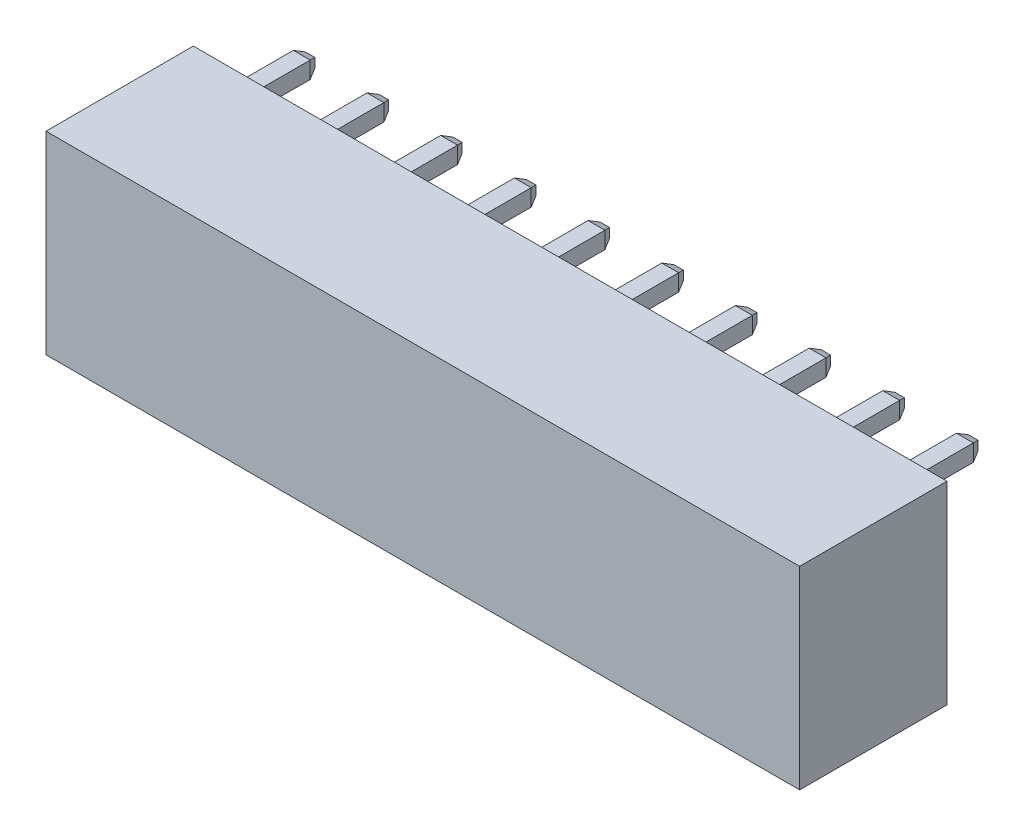
from build123d import *
from OCP.BRepFilletAPI import BRepFilletAPI_MakeChamfer

# Parameters (mm, degrees)
SKETCH_1_W                          = 35.8
SKETCH_1_H                          = 9.2
EXTRUDE_1_DEPTH                     = 7
SKETCH_2_W                          = 0.8
SKETCH_2_H                          = 0.8
EXTRUDE_2_DEPTH                     = 3.4
CHAMFER_1_SIZE                      = 0.4
CHAMFER_1_SIZE2                     = 0.178091474
CUT_EXTRUDE_1_DEPTH                 = 7
PATTERN_LINEAR_1_COUNT              = 10
PATTERN_LINEAR_1_PITCH              = 3.5
CHAMFER_1_OF_PATTERN_LINEAR_1_SIZE  = 0.4
CHAMFER_1_OF_PATTERN_LINEAR_1_SIZE2 = 0.178091474
PATTERN_LINEAR_2_COUNT              = 10
PATTERN_LINEAR_2_PITCH              = 3.5
SKETCH_4_W                          = 0.8
SKETCH_4_H                          = 0.8
EXTRUDE_3_DEPTH                     = 6
CHAMFER_2_SIZE                      = 0.4
CHAMFER_2_SIZE2                     = 0.178091474
PATTERN_LINEAR_3_COUNT              = 10
PATTERN_LINEAR_3_PITCH              = 3.5
CHAMFER_2_OF_PATTERN_LINEAR_3_SIZE  = 0.4
CHAMFER_2_OF_PATTERN_LINEAR_3_SIZE2 = 0.178091474


with BuildPart() as part:
    # Эскиз1 → Бобышка-Вытянуть1 (new body)
    with BuildSketch(Plane.XY):
        with Locations((0, 4.6)):
            Rectangle(SKETCH_1_W, SKETCH_1_H)
    extrude(amount=EXTRUDE_1_DEPTH)

    # Эскиз2 → Бобышка-Вытянуть2 (add)
    with BuildSketch(Plane(origin=(0, 0, 0), x_dir=(-1, 0, 0), z_dir=(0, 0, -1))):
        with Locations((-15.75, 8)):
            Rectangle(SKETCH_2_W, SKETCH_2_H)
    extrude_2 = extrude(amount=EXTRUDE_2_DEPTH)

    # Фаска1: one chamfer whose edges measure the first distance from different faces: ONE call of the kernel's chamfer builder (chamfer() names one face for all edges)
    chamfer_1_edges_1 = [part.edges().sort_by_distance(p)[0] for p in [
        (15.75, 8.4, -3.4),
    ]]
    chamfer_1_side_1 = [part.faces().sort_by_distance(p)[0] for p in [
        (15.75, 8.4, -1.7),
    ]]
    chamfer_1_edges_2 = [part.edges().sort_by_distance(p)[0] for p in [
        (15.35, 8, -3.4),
    ]]
    chamfer_1_side_2 = [part.faces().sort_by_distance(p)[0] for p in [
        (15.35, 8, -1.7),
    ]]
    chamfer_1_edges_3 = [part.edges().sort_by_distance(p)[0] for p in [
        (15.75, 7.6, -3.4),
    ]]
    chamfer_1_side_3 = [part.faces().sort_by_distance(p)[0] for p in [
        (15.75, 7.6, -1.7),
    ]]
    chamfer_1_edges_4 = [part.edges().sort_by_distance(p)[0] for p in [
        (16.15, 8, -3.4),
    ]]
    chamfer_1_side_4 = [part.faces().sort_by_distance(p)[0] for p in [
        (16.15, 8, -1.7),
    ]]
    chamfer_1 = BRepFilletAPI_MakeChamfer(part.part.solid().wrapped)
    for e in chamfer_1_edges_1:
        chamfer_1.Add(CHAMFER_1_SIZE, CHAMFER_1_SIZE2, e.wrapped, chamfer_1_side_1[0].wrapped)  # the first distance lies on this face
    for e in chamfer_1_edges_2:
        chamfer_1.Add(CHAMFER_1_SIZE, CHAMFER_1_SIZE2, e.wrapped, chamfer_1_side_2[0].wrapped)  # the first distance lies on this face
    for e in chamfer_1_edges_3:
        chamfer_1.Add(CHAMFER_1_SIZE, CHAMFER_1_SIZE2, e.wrapped, chamfer_1_side_3[0].wrapped)  # the first distance lies on this face
    for e in chamfer_1_edges_4:
        chamfer_1.Add(CHAMFER_1_SIZE, CHAMFER_1_SIZE2, e.wrapped, chamfer_1_side_4[0].wrapped)  # the first distance lies on this face
    add(Compound.cast(chamfer_1.Shape()), mode=Mode.REPLACE)

    # Эскиз3 → Вырез-Вытянуть1 (cut)
    with BuildSketch(Plane.XZ):
        Polygon((14.15, 0.8), (17.25, 0.8), (17.25, 5), (16.25, 5), (17.25, 6.5), (14.15, 6.5), (15.15, 5), (14.15, 5), align=None)
    cut_extrude_1 = extrude(amount=-CUT_EXTRUDE_1_DEPTH, mode=Mode.SUBTRACT)

    # Линейный массив1: Бобышка-Вытянуть2 ×10
    with Locations(*[(-i * PATTERN_LINEAR_1_PITCH, 0, 0) for i in range(1, PATTERN_LINEAR_1_COUNT)]):
        add(extrude_2)

    # Фаска1 of Линейный массив1: one chamfer whose edges measure the first distance from different faces: ONE call of the kernel's chamfer builder (chamfer() names one face for all edges)
    chamfer_1_of_pattern_linear_1_edges_1 = [part.edges().sort_by_distance(p)[0] for p in [
        (12.25, 8.4, -3.4),
    ]]
    chamfer_1_of_pattern_linear_1_side_1 = [part.faces().sort_by_distance(p)[0] for p in [
        (12.25, 8.4, -1.7),
    ]]
    chamfer_1_of_pattern_linear_1_edges_2 = [part.edges().sort_by_distance(p)[0] for p in [
        (11.85, 8, -3.4),
    ]]
    chamfer_1_of_pattern_linear_1_side_2 = [part.faces().sort_by_distance(p)[0] for p in [
        (11.85, 8, -1.7),
    ]]
    chamfer_1_of_pattern_linear_1_edges_3 = [part.edges().sort_by_distance(p)[0] for p in [
        (12.25, 7.6, -3.4),
    ]]
    chamfer_1_of_pattern_linear_1_side_3 = [part.faces().sort_by_distance(p)[0] for p in [
        (12.25, 7.6, -1.7),
    ]]
    chamfer_1_of_pattern_linear_1_edges_4 = [part.edges().sort_by_distance(p)[0] for p in [
        (12.65, 8, -3.4),
    ]]
    chamfer_1_of_pattern_linear_1_side_4 = [part.faces().sort_by_distance(p)[0] for p in [
        (12.65, 8, -1.7),
    ]]
    chamfer_1_of_pattern_linear_1_edges_5 = [part.edges().sort_by_distance(p)[0] for p in [
        (8.75, 8.4, -3.4),
    ]]
    chamfer_1_of_pattern_linear_1_side_5 = [part.faces().sort_by_distance(p)[0] for p in [
        (8.75, 8.4, -1.7),
    ]]
    chamfer_1_of_pattern_linear_1_edges_6 = [part.edges().sort_by_distance(p)[0] for p in [
        (8.35, 8, -3.4),
    ]]
    chamfer_1_of_pattern_linear_1_side_6 = [part.faces().sort_by_distance(p)[0] for p in [
        (8.35, 8, -1.7),
    ]]
    chamfer_1_of_pattern_linear_1_edges_7 = [part.edges().sort_by_distance(p)[0] for p in [
        (8.75, 7.6, -3.4),
    ]]
    chamfer_1_of_pattern_linear_1_side_7 = [part.faces().sort_by_distance(p)[0] for p in [
        (8.75, 7.6, -1.7),
    ]]
    chamfer_1_of_pattern_linear_1_edges_8 = [part.edges().sort_by_distance(p)[0] for p in [
        (9.15, 8, -3.4),
    ]]
    chamfer_1_of_pattern_linear_1_side_8 = [part.faces().sort_by_distance(p)[0] for p in [
        (9.15, 8, -1.7),
    ]]
    chamfer_1_of_pattern_linear_1_edges_9 = [part.edges().sort_by_distance(p)[0] for p in [
        (5.25, 8.4, -3.4),
    ]]
    chamfer_1_of_pattern_linear_1_side_9 = [part.faces().sort_by_distance(p)[0] for p in [
        (5.25, 8.4, -1.7),
    ]]
    chamfer_1_of_pattern_linear_1_edges_10 = [part.edges().sort_by_distance(p)[0] for p in [
        (4.85, 8, -3.4),
    ]]
    chamfer_1_of_pattern_linear_1_side_10 = [part.faces().sort_by_distance(p)[0] for p in [
        (4.85, 8, -1.7),
    ]]
    chamfer_1_of_pattern_linear_1_edges_11 = [part.edges().sort_by_distance(p)[0] for p in [
        (5.25, 7.6, -3.4),
    ]]
    chamfer_1_of_pattern_linear_1_side_11 = [part.faces().sort_by_distance(p)[0] for p in [
        (5.25, 7.6, -1.7),
    ]]
    chamfer_1_of_pattern_linear_1_edges_12 = [part.edges().sort_by_distance(p)[0] for p in [
        (5.65, 8, -3.4),
    ]]
    chamfer_1_of_pattern_linear_1_side_12 = [part.faces().sort_by_distance(p)[0] for p in [
        (5.65, 8, -1.7),
    ]]
    chamfer_1_of_pattern_linear_1_edges_13 = [part.edges().sort_by_distance(p)[0] for p in [
        (1.75, 8.4, -3.4),
    ]]
    chamfer_1_of_pattern_linear_1_side_13 = [part.faces().sort_by_distance(p)[0] for p in [
        (1.75, 8.4, -1.7),
    ]]
    chamfer_1_of_pattern_linear_1_edges_14 = [part.edges().sort_by_distance(p)[0] for p in [
        (1.35, 8, -3.4),
    ]]
    chamfer_1_of_pattern_linear_1_side_14 = [part.faces().sort_by_distance(p)[0] for p in [
        (1.35, 8, -1.7),
    ]]
    chamfer_1_of_pattern_linear_1_edges_15 = [part.edges().sort_by_distance(p)[0] for p in [
        (1.75, 7.6, -3.4),
    ]]
    chamfer_1_of_pattern_linear_1_side_15 = [part.faces().sort_by_distance(p)[0] for p in [
        (1.75, 7.6, -1.7),
    ]]
    chamfer_1_of_pattern_linear_1_edges_16 = [part.edges().sort_by_distance(p)[0] for p in [
        (2.15, 8, -3.4),
    ]]
    chamfer_1_of_pattern_linear_1_side_16 = [part.faces().sort_by_distance(p)[0] for p in [
        (2.15, 8, -1.7),
    ]]
    chamfer_1_of_pattern_linear_1_edges_17 = [part.edges().sort_by_distance(p)[0] for p in [
        (-1.75, 8.4, -3.4),
    ]]
    chamfer_1_of_pattern_linear_1_side_17 = [part.faces().sort_by_distance(p)[0] for p in [
        (-1.75, 8.4, -1.7),
    ]]
    chamfer_1_of_pattern_linear_1_edges_18 = [part.edges().sort_by_distance(p)[0] for p in [
        (-2.15, 8, -3.4),
    ]]
    chamfer_1_of_pattern_linear_1_side_18 = [part.faces().sort_by_distance(p)[0] for p in [
        (-2.15, 8, -1.7),
    ]]
    chamfer_1_of_pattern_linear_1_edges_19 = [part.edges().sort_by_distance(p)[0] for p in [
        (-1.75, 7.6, -3.4),
    ]]
    chamfer_1_of_pattern_linear_1_side_19 = [part.faces().sort_by_distance(p)[0] for p in [
        (-1.75, 7.6, -1.7),
    ]]
    chamfer_1_of_pattern_linear_1_edges_20 = [part.edges().sort_by_distance(p)[0] for p in [
        (-1.35, 8, -3.4),
    ]]
    chamfer_1_of_pattern_linear_1_side_20 = [part.faces().sort_by_distance(p)[0] for p in [
        (-1.35, 8, -1.7),
    ]]
    chamfer_1_of_pattern_linear_1_edges_21 = [part.edges().sort_by_distance(p)[0] for p in [
        (-5.25, 8.4, -3.4),
    ]]
    chamfer_1_of_pattern_linear_1_side_21 = [part.faces().sort_by_distance(p)[0] for p in [
        (-5.25, 8.4, -1.7),
    ]]
    chamfer_1_of_pattern_linear_1_edges_22 = [part.edges().sort_by_distance(p)[0] for p in [
        (-5.65, 8, -3.4),
    ]]
    chamfer_1_of_pattern_linear_1_side_22 = [part.faces().sort_by_distance(p)[0] for p in [
        (-5.65, 8, -1.7),
    ]]
    chamfer_1_of_pattern_linear_1_edges_23 = [part.edges().sort_by_distance(p)[0] for p in [
        (-5.25, 7.6, -3.4),
    ]]
    chamfer_1_of_pattern_linear_1_side_23 = [part.faces().sort_by_distance(p)[0] for p in [
        (-5.25, 7.6, -1.7),
    ]]
    chamfer_1_of_pattern_linear_1_edges_24 = [part.edges().sort_by_distance(p)[0] for p in [
        (-4.85, 8, -3.4),
    ]]
    chamfer_1_of_pattern_linear_1_side_24 = [part.faces().sort_by_distance(p)[0] for p in [
        (-4.85, 8, -1.7),
    ]]
    chamfer_1_of_pattern_linear_1_edges_25 = [part.edges().sort_by_distance(p)[0] for p in [
        (-8.75, 8.4, -3.4),
    ]]
    chamfer_1_of_pattern_linear_1_side_25 = [part.faces().sort_by_distance(p)[0] for p in [
        (-8.75, 8.4, -1.7),
    ]]
    chamfer_1_of_pattern_linear_1_edges_26 = [part.edges().sort_by_distance(p)[0] for p in [
        (-9.15, 8, -3.4),
    ]]
    chamfer_1_of_pattern_linear_1_side_26 = [part.faces().sort_by_distance(p)[0] for p in [
        (-9.15, 8, -1.7),
    ]]
    chamfer_1_of_pattern_linear_1_edges_27 = [part.edges().sort_by_distance(p)[0] for p in [
        (-8.75, 7.6, -3.4),
    ]]
    chamfer_1_of_pattern_linear_1_side_27 = [part.faces().sort_by_distance(p)[0] for p in [
        (-8.75, 7.6, -1.7),
    ]]
    chamfer_1_of_pattern_linear_1_edges_28 = [part.edges().sort_by_distance(p)[0] for p in [
        (-8.35, 8, -3.4),
    ]]
    chamfer_1_of_pattern_linear_1_side_28 = [part.faces().sort_by_distance(p)[0] for p in [
        (-8.35, 8, -1.7),
    ]]
    chamfer_1_of_pattern_linear_1_edges_29 = [part.edges().sort_by_distance(p)[0] for p in [
        (-12.25, 8.4, -3.4),
    ]]
    chamfer_1_of_pattern_linear_1_side_29 = [part.faces().sort_by_distance(p)[0] for p in [
        (-12.25, 8.4, -1.7),
    ]]
    chamfer_1_of_pattern_linear_1_edges_30 = [part.edges().sort_by_distance(p)[0] for p in [
        (-12.65, 8, -3.4),
    ]]
    chamfer_1_of_pattern_linear_1_side_30 = [part.faces().sort_by_distance(p)[0] for p in [
        (-12.65, 8, -1.7),
    ]]
    chamfer_1_of_pattern_linear_1_edges_31 = [part.edges().sort_by_distance(p)[0] for p in [
        (-12.25, 7.6, -3.4),
    ]]
    chamfer_1_of_pattern_linear_1_side_31 = [part.faces().sort_by_distance(p)[0] for p in [
        (-12.25, 7.6, -1.7),
    ]]
    chamfer_1_of_pattern_linear_1_edges_32 = [part.edges().sort_by_distance(p)[0] for p in [
        (-11.85, 8, -3.4),
    ]]
    chamfer_1_of_pattern_linear_1_side_32 = [part.faces().sort_by_distance(p)[0] for p in [
        (-11.85, 8, -1.7),
    ]]
    chamfer_1_of_pattern_linear_1_edges_33 = [part.edges().sort_by_distance(p)[0] for p in [
        (-15.75, 8.4, -3.4),
    ]]
    chamfer_1_of_pattern_linear_1_side_33 = [part.faces().sort_by_distance(p)[0] for p in [
        (-15.75, 8.4, -1.7),
    ]]
    chamfer_1_of_pattern_linear_1_edges_34 = [part.edges().sort_by_distance(p)[0] for p in [
        (-16.15, 8, -3.4),
    ]]
    chamfer_1_of_pattern_linear_1_side_34 = [part.faces().sort_by_distance(p)[0] for p in [
        (-16.15, 8, -1.7),
    ]]
    chamfer_1_of_pattern_linear_1_edges_35 = [part.edges().sort_by_distance(p)[0] for p in [
        (-15.75, 7.6, -3.4),
    ]]
    chamfer_1_of_pattern_linear_1_side_35 = [part.faces().sort_by_distance(p)[0] for p in [
        (-15.75, 7.6, -1.7),
    ]]
    chamfer_1_of_pattern_linear_1_edges_36 = [part.edges().sort_by_distance(p)[0] for p in [
        (-15.35, 8, -3.4),
    ]]
    chamfer_1_of_pattern_linear_1_side_36 = [part.faces().sort_by_distance(p)[0] for p in [
        (-15.35, 8, -1.7),
    ]]
    chamfer_1_of_pattern_linear_1 = BRepFilletAPI_MakeChamfer(part.part.solid().wrapped)
    for e in chamfer_1_of_pattern_linear_1_edges_1:
        chamfer_1_of_pattern_linear_1.Add(CHAMFER_1_OF_PATTERN_LINEAR_1_SIZE, CHAMFER_1_OF_PATTERN_LINEAR_1_SIZE2, e.wrapped, chamfer_1_of_pattern_linear_1_side_1[0].wrapped)  # the first distance lies on this face
    for e in chamfer_1_of_pattern_linear_1_edges_2:
        chamfer_1_of_pattern_linear_1.Add(CHAMFER_1_OF_PATTERN_LINEAR_1_SIZE, CHAMFER_1_OF_PATTERN_LINEAR_1_SIZE2, e.wrapped, chamfer_1_of_pattern_linear_1_side_2[0].wrapped)  # the first distance lies on this face
    for e in chamfer_1_of_pattern_linear_1_edges_3:
        chamfer_1_of_pattern_linear_1.Add(CHAMFER_1_OF_PATTERN_LINEAR_1_SIZE, CHAMFER_1_OF_PATTERN_LINEAR_1_SIZE2, e.wrapped, chamfer_1_of_pattern_linear_1_side_3[0].wrapped)  # the first distance lies on this face
    for e in chamfer_1_of_pattern_linear_1_edges_4:
        chamfer_1_of_pattern_linear_1.Add(CHAMFER_1_OF_PATTERN_LINEAR_1_SIZE, CHAMFER_1_OF_PATTERN_LINEAR_1_SIZE2, e.wrapped, chamfer_1_of_pattern_linear_1_side_4[0].wrapped)  # the first distance lies on this face
    for e in chamfer_1_of_pattern_linear_1_edges_5:
        chamfer_1_of_pattern_linear_1.Add(CHAMFER_1_OF_PATTERN_LINEAR_1_SIZE, CHAMFER_1_OF_PATTERN_LINEAR_1_SIZE2, e.wrapped, chamfer_1_of_pattern_linear_1_side_5[0].wrapped)  # the first distance lies on this face
    for e in chamfer_1_of_pattern_linear_1_edges_6:
        chamfer_1_of_pattern_linear_1.Add(CHAMFER_1_OF_PATTERN_LINEAR_1_SIZE, CHAMFER_1_OF_PATTERN_LINEAR_1_SIZE2, e.wrapped, chamfer_1_of_pattern_linear_1_side_6[0].wrapped)  # the first distance lies on this face
    for e in chamfer_1_of_pattern_linear_1_edges_7:
        chamfer_1_of_pattern_linear_1.Add(CHAMFER_1_OF_PATTERN_LINEAR_1_SIZE, CHAMFER_1_OF_PATTERN_LINEAR_1_SIZE2, e.wrapped, chamfer_1_of_pattern_linear_1_side_7[0].wrapped)  # the first distance lies on this face
    for e in chamfer_1_of_pattern_linear_1_edges_8:
        chamfer_1_of_pattern_linear_1.Add(CHAMFER_1_OF_PATTERN_LINEAR_1_SIZE, CHAMFER_1_OF_PATTERN_LINEAR_1_SIZE2, e.wrapped, chamfer_1_of_pattern_linear_1_side_8[0].wrapped)  # the first distance lies on this face
    for e in chamfer_1_of_pattern_linear_1_edges_9:
        chamfer_1_of_pattern_linear_1.Add(CHAMFER_1_OF_PATTERN_LINEAR_1_SIZE, CHAMFER_1_OF_PATTERN_LINEAR_1_SIZE2, e.wrapped, chamfer_1_of_pattern_linear_1_side_9[0].wrapped)  # the first distance lies on this face
    for e in chamfer_1_of_pattern_linear_1_edges_10:
        chamfer_1_of_pattern_linear_1.Add(CHAMFER_1_OF_PATTERN_LINEAR_1_SIZE, CHAMFER_1_OF_PATTERN_LINEAR_1_SIZE2, e.wrapped, chamfer_1_of_pattern_linear_1_side_10[0].wrapped)  # the first distance lies on this face
    for e in chamfer_1_of_pattern_linear_1_edges_11:
        chamfer_1_of_pattern_linear_1.Add(CHAMFER_1_OF_PATTERN_LINEAR_1_SIZE, CHAMFER_1_OF_PATTERN_LINEAR_1_SIZE2, e.wrapped, chamfer_1_of_pattern_linear_1_side_11[0].wrapped)  # the first distance lies on this face
    for e in chamfer_1_of_pattern_linear_1_edges_12:
        chamfer_1_of_pattern_linear_1.Add(CHAMFER_1_OF_PATTERN_LINEAR_1_SIZE, CHAMFER_1_OF_PATTERN_LINEAR_1_SIZE2, e.wrapped, chamfer_1_of_pattern_linear_1_side_12[0].wrapped)  # the first distance lies on this face
    for e in chamfer_1_of_pattern_linear_1_edges_13:
        chamfer_1_of_pattern_linear_1.Add(CHAMFER_1_OF_PATTERN_LINEAR_1_SIZE, CHAMFER_1_OF_PATTERN_LINEAR_1_SIZE2, e.wrapped, chamfer_1_of_pattern_linear_1_side_13[0].wrapped)  # the first distance lies on this face
    for e in chamfer_1_of_pattern_linear_1_edges_14:
        chamfer_1_of_pattern_linear_1.Add(CHAMFER_1_OF_PATTERN_LINEAR_1_SIZE, CHAMFER_1_OF_PATTERN_LINEAR_1_SIZE2, e.wrapped, chamfer_1_of_pattern_linear_1_side_14[0].wrapped)  # the first distance lies on this face
    for e in chamfer_1_of_pattern_linear_1_edges_15:
        chamfer_1_of_pattern_linear_1.Add(CHAMFER_1_OF_PATTERN_LINEAR_1_SIZE, CHAMFER_1_OF_PATTERN_LINEAR_1_SIZE2, e.wrapped, chamfer_1_of_pattern_linear_1_side_15[0].wrapped)  # the first distance lies on this face
    for e in chamfer_1_of_pattern_linear_1_edges_16:
        chamfer_1_of_pattern_linear_1.Add(CHAMFER_1_OF_PATTERN_LINEAR_1_SIZE, CHAMFER_1_OF_PATTERN_LINEAR_1_SIZE2, e.wrapped, chamfer_1_of_pattern_linear_1_side_16[0].wrapped)  # the first distance lies on this face
    for e in chamfer_1_of_pattern_linear_1_edges_17:
        chamfer_1_of_pattern_linear_1.Add(CHAMFER_1_OF_PATTERN_LINEAR_1_SIZE, CHAMFER_1_OF_PATTERN_LINEAR_1_SIZE2, e.wrapped, chamfer_1_of_pattern_linear_1_side_17[0].wrapped)  # the first distance lies on this face
    for e in chamfer_1_of_pattern_linear_1_edges_18:
        chamfer_1_of_pattern_linear_1.Add(CHAMFER_1_OF_PATTERN_LINEAR_1_SIZE, CHAMFER_1_OF_PATTERN_LINEAR_1_SIZE2, e.wrapped, chamfer_1_of_pattern_linear_1_side_18[0].wrapped)  # the first distance lies on this face
    for e in chamfer_1_of_pattern_linear_1_edges_19:
        chamfer_1_of_pattern_linear_1.Add(CHAMFER_1_OF_PATTERN_LINEAR_1_SIZE, CHAMFER_1_OF_PATTERN_LINEAR_1_SIZE2, e.wrapped, chamfer_1_of_pattern_linear_1_side_19[0].wrapped)  # the first distance lies on this face
    for e in chamfer_1_of_pattern_linear_1_edges_20:
        chamfer_1_of_pattern_linear_1.Add(CHAMFER_1_OF_PATTERN_LINEAR_1_SIZE, CHAMFER_1_OF_PATTERN_LINEAR_1_SIZE2, e.wrapped, chamfer_1_of_pattern_linear_1_side_20[0].wrapped)  # the first distance lies on this face
    for e in chamfer_1_of_pattern_linear_1_edges_21:
        chamfer_1_of_pattern_linear_1.Add(CHAMFER_1_OF_PATTERN_LINEAR_1_SIZE, CHAMFER_1_OF_PATTERN_LINEAR_1_SIZE2, e.wrapped, chamfer_1_of_pattern_linear_1_side_21[0].wrapped)  # the first distance lies on this face
    for e in chamfer_1_of_pattern_linear_1_edges_22:
        chamfer_1_of_pattern_linear_1.Add(CHAMFER_1_OF_PATTERN_LINEAR_1_SIZE, CHAMFER_1_OF_PATTERN_LINEAR_1_SIZE2, e.wrapped, chamfer_1_of_pattern_linear_1_side_22[0].wrapped)  # the first distance lies on this face
    for e in chamfer_1_of_pattern_linear_1_edges_23:
        chamfer_1_of_pattern_linear_1.Add(CHAMFER_1_OF_PATTERN_LINEAR_1_SIZE, CHAMFER_1_OF_PATTERN_LINEAR_1_SIZE2, e.wrapped, chamfer_1_of_pattern_linear_1_side_23[0].wrapped)  # the first distance lies on this face
    for e in chamfer_1_of_pattern_linear_1_edges_24:
        chamfer_1_of_pattern_linear_1.Add(CHAMFER_1_OF_PATTERN_LINEAR_1_SIZE, CHAMFER_1_OF_PATTERN_LINEAR_1_SIZE2, e.wrapped, chamfer_1_of_pattern_linear_1_side_24[0].wrapped)  # the first distance lies on this face
    for e in chamfer_1_of_pattern_linear_1_edges_25:
        chamfer_1_of_pattern_linear_1.Add(CHAMFER_1_OF_PATTERN_LINEAR_1_SIZE, CHAMFER_1_OF_PATTERN_LINEAR_1_SIZE2, e.wrapped, chamfer_1_of_pattern_linear_1_side_25[0].wrapped)  # the first distance lies on this face
    for e in chamfer_1_of_pattern_linear_1_edges_26:
        chamfer_1_of_pattern_linear_1.Add(CHAMFER_1_OF_PATTERN_LINEAR_1_SIZE, CHAMFER_1_OF_PATTERN_LINEAR_1_SIZE2, e.wrapped, chamfer_1_of_pattern_linear_1_side_26[0].wrapped)  # the first distance lies on this face
    for e in chamfer_1_of_pattern_linear_1_edges_27:
        chamfer_1_of_pattern_linear_1.Add(CHAMFER_1_OF_PATTERN_LINEAR_1_SIZE, CHAMFER_1_OF_PATTERN_LINEAR_1_SIZE2, e.wrapped, chamfer_1_of_pattern_linear_1_side_27[0].wrapped)  # the first distance lies on this face
    for e in chamfer_1_of_pattern_linear_1_edges_28:
        chamfer_1_of_pattern_linear_1.Add(CHAMFER_1_OF_PATTERN_LINEAR_1_SIZE, CHAMFER_1_OF_PATTERN_LINEAR_1_SIZE2, e.wrapped, chamfer_1_of_pattern_linear_1_side_28[0].wrapped)  # the first distance lies on this face
    for e in chamfer_1_of_pattern_linear_1_edges_29:
        chamfer_1_of_pattern_linear_1.Add(CHAMFER_1_OF_PATTERN_LINEAR_1_SIZE, CHAMFER_1_OF_PATTERN_LINEAR_1_SIZE2, e.wrapped, chamfer_1_of_pattern_linear_1_side_29[0].wrapped)  # the first distance lies on this face
    for e in chamfer_1_of_pattern_linear_1_edges_30:
        chamfer_1_of_pattern_linear_1.Add(CHAMFER_1_OF_PATTERN_LINEAR_1_SIZE, CHAMFER_1_OF_PATTERN_LINEAR_1_SIZE2, e.wrapped, chamfer_1_of_pattern_linear_1_side_30[0].wrapped)  # the first distance lies on this face
    for e in chamfer_1_of_pattern_linear_1_edges_31:
        chamfer_1_of_pattern_linear_1.Add(CHAMFER_1_OF_PATTERN_LINEAR_1_SIZE, CHAMFER_1_OF_PATTERN_LINEAR_1_SIZE2, e.wrapped, chamfer_1_of_pattern_linear_1_side_31[0].wrapped)  # the first distance lies on this face
    for e in chamfer_1_of_pattern_linear_1_edges_32:
        chamfer_1_of_pattern_linear_1.Add(CHAMFER_1_OF_PATTERN_LINEAR_1_SIZE, CHAMFER_1_OF_PATTERN_LINEAR_1_SIZE2, e.wrapped, chamfer_1_of_pattern_linear_1_side_32[0].wrapped)  # the first distance lies on this face
    for e in chamfer_1_of_pattern_linear_1_edges_33:
        chamfer_1_of_pattern_linear_1.Add(CHAMFER_1_OF_PATTERN_LINEAR_1_SIZE, CHAMFER_1_OF_PATTERN_LINEAR_1_SIZE2, e.wrapped, chamfer_1_of_pattern_linear_1_side_33[0].wrapped)  # the first distance lies on this face
    for e in chamfer_1_of_pattern_linear_1_edges_34:
        chamfer_1_of_pattern_linear_1.Add(CHAMFER_1_OF_PATTERN_LINEAR_1_SIZE, CHAMFER_1_OF_PATTERN_LINEAR_1_SIZE2, e.wrapped, chamfer_1_of_pattern_linear_1_side_34[0].wrapped)  # the first distance lies on this face
    for e in chamfer_1_of_pattern_linear_1_edges_35:
        chamfer_1_of_pattern_linear_1.Add(CHAMFER_1_OF_PATTERN_LINEAR_1_SIZE, CHAMFER_1_OF_PATTERN_LINEAR_1_SIZE2, e.wrapped, chamfer_1_of_pattern_linear_1_side_35[0].wrapped)  # the first distance lies on this face
    for e in chamfer_1_of_pattern_linear_1_edges_36:
        chamfer_1_of_pattern_linear_1.Add(CHAMFER_1_OF_PATTERN_LINEAR_1_SIZE, CHAMFER_1_OF_PATTERN_LINEAR_1_SIZE2, e.wrapped, chamfer_1_of_pattern_linear_1_side_36[0].wrapped)  # the first distance lies on this face
    add(Compound.cast(chamfer_1_of_pattern_linear_1.Shape()), mode=Mode.REPLACE)

    # Линейный массив2: Вырез-Вытянуть1 ×10
    with Locations(*[(-i * PATTERN_LINEAR_2_PITCH, 0, 0) for i in range(1, PATTERN_LINEAR_2_COUNT)]):
        add(cut_extrude_1, mode=Mode.SUBTRACT)

    # Эскиз4 → Бобышка-Вытянуть3 (add)
    with BuildSketch(Plane.XZ.offset(-7)):
        with Locations((15.75, 3)):
            Rectangle(SKETCH_4_W, SKETCH_4_H)
    extrude_3 = extrude(amount=EXTRUDE_3_DEPTH)

    # Фаска2: one chamfer whose edges measure the first distance from different faces: ONE call of the kernel's chamfer builder (chamfer() names one face for all edges)
    chamfer_2_edges_1 = [part.edges().sort_by_distance(p)[0] for p in [
        (16.15, 1, 3),
    ]]
    chamfer_2_side_1 = [part.faces().sort_by_distance(p)[0] for p in [
        (16.15, 4, 3),
    ]]
    chamfer_2_edges_2 = [part.edges().sort_by_distance(p)[0] for p in [
        (15.75, 1, 3.4),
    ]]
    chamfer_2_side_2 = [part.faces().sort_by_distance(p)[0] for p in [
        (15.75, 4, 3.4),
    ]]
    chamfer_2_edges_3 = [part.edges().sort_by_distance(p)[0] for p in [
        (15.35, 1, 3),
    ]]
    chamfer_2_side_3 = [part.faces().sort_by_distance(p)[0] for p in [
        (15.35, 4, 3),
    ]]
    chamfer_2_edges_4 = [part.edges().sort_by_distance(p)[0] for p in [
        (15.75, 1, 2.6),
    ]]
    chamfer_2_side_4 = [part.faces().sort_by_distance(p)[0] for p in [
        (15.75, 4, 2.6),
    ]]
    chamfer_2 = BRepFilletAPI_MakeChamfer(part.part.solid().wrapped)
    for e in chamfer_2_edges_1:
        chamfer_2.Add(CHAMFER_2_SIZE, CHAMFER_2_SIZE2, e.wrapped, chamfer_2_side_1[0].wrapped)  # the first distance lies on this face
    for e in chamfer_2_edges_2:
        chamfer_2.Add(CHAMFER_2_SIZE, CHAMFER_2_SIZE2, e.wrapped, chamfer_2_side_2[0].wrapped)  # the first distance lies on this face
    for e in chamfer_2_edges_3:
        chamfer_2.Add(CHAMFER_2_SIZE, CHAMFER_2_SIZE2, e.wrapped, chamfer_2_side_3[0].wrapped)  # the first distance lies on this face
    for e in chamfer_2_edges_4:
        chamfer_2.Add(CHAMFER_2_SIZE, CHAMFER_2_SIZE2, e.wrapped, chamfer_2_side_4[0].wrapped)  # the first distance lies on this face
    add(Compound.cast(chamfer_2.Shape()), mode=Mode.REPLACE)

    # Линейный массив3: Бобышка-Вытянуть3 ×10
    with Locations(*[(-i * PATTERN_LINEAR_3_PITCH, 0, 0) for i in range(1, PATTERN_LINEAR_3_COUNT)]):
        add(extrude_3)

    # Фаска2 of Линейный массив3: one chamfer whose edges measure the first distance from different faces: ONE call of the kernel's chamfer builder (chamfer() names one face for all edges)
    chamfer_2_of_pattern_linear_3_edges_1 = [part.edges().sort_by_distance(p)[0] for p in [
        (12.65, 1, 3),
    ]]
    chamfer_2_of_pattern_linear_3_side_1 = [part.faces().sort_by_distance(p)[0] for p in [
        (12.65, 4, 3),
    ]]
    chamfer_2_of_pattern_linear_3_edges_2 = [part.edges().sort_by_distance(p)[0] for p in [
        (12.25, 1, 3.4),
    ]]
    chamfer_2_of_pattern_linear_3_side_2 = [part.faces().sort_by_distance(p)[0] for p in [
        (12.25, 4, 3.4),
    ]]
    chamfer_2_of_pattern_linear_3_edges_3 = [part.edges().sort_by_distance(p)[0] for p in [
        (11.85, 1, 3),
    ]]
    chamfer_2_of_pattern_linear_3_side_3 = [part.faces().sort_by_distance(p)[0] for p in [
        (11.85, 4, 3),
    ]]
    chamfer_2_of_pattern_linear_3_edges_4 = [part.edges().sort_by_distance(p)[0] for p in [
        (12.25, 1, 2.6),
    ]]
    chamfer_2_of_pattern_linear_3_side_4 = [part.faces().sort_by_distance(p)[0] for p in [
        (12.25, 4, 2.6),
    ]]
    chamfer_2_of_pattern_linear_3_edges_5 = [part.edges().sort_by_distance(p)[0] for p in [
        (9.15, 1, 3),
    ]]
    chamfer_2_of_pattern_linear_3_side_5 = [part.faces().sort_by_distance(p)[0] for p in [
        (9.15, 4, 3),
    ]]
    chamfer_2_of_pattern_linear_3_edges_6 = [part.edges().sort_by_distance(p)[0] for p in [
        (8.75, 1, 3.4),
    ]]
    chamfer_2_of_pattern_linear_3_side_6 = [part.faces().sort_by_distance(p)[0] for p in [
        (8.75, 4, 3.4),
    ]]
    chamfer_2_of_pattern_linear_3_edges_7 = [part.edges().sort_by_distance(p)[0] for p in [
        (8.35, 1, 3),
    ]]
    chamfer_2_of_pattern_linear_3_side_7 = [part.faces().sort_by_distance(p)[0] for p in [
        (8.35, 4, 3),
    ]]
    chamfer_2_of_pattern_linear_3_edges_8 = [part.edges().sort_by_distance(p)[0] for p in [
        (8.75, 1, 2.6),
    ]]
    chamfer_2_of_pattern_linear_3_side_8 = [part.faces().sort_by_distance(p)[0] for p in [
        (8.75, 4, 2.6),
    ]]
    chamfer_2_of_pattern_linear_3_edges_9 = [part.edges().sort_by_distance(p)[0] for p in [
        (5.65, 1, 3),
    ]]
    chamfer_2_of_pattern_linear_3_side_9 = [part.faces().sort_by_distance(p)[0] for p in [
        (5.65, 4, 3),
    ]]
    chamfer_2_of_pattern_linear_3_edges_10 = [part.edges().sort_by_distance(p)[0] for p in [
        (5.25, 1, 3.4),
    ]]
    chamfer_2_of_pattern_linear_3_side_10 = [part.faces().sort_by_distance(p)[0] for p in [
        (5.25, 4, 3.4),
    ]]
    chamfer_2_of_pattern_linear_3_edges_11 = [part.edges().sort_by_distance(p)[0] for p in [
        (4.85, 1, 3),
    ]]
    chamfer_2_of_pattern_linear_3_side_11 = [part.faces().sort_by_distance(p)[0] for p in [
        (4.85, 4, 3),
    ]]
    chamfer_2_of_pattern_linear_3_edges_12 = [part.edges().sort_by_distance(p)[0] for p in [
        (5.25, 1, 2.6),
    ]]
    chamfer_2_of_pattern_linear_3_side_12 = [part.faces().sort_by_distance(p)[0] for p in [
        (5.25, 4, 2.6),
    ]]
    chamfer_2_of_pattern_linear_3_edges_13 = [part.edges().sort_by_distance(p)[0] for p in [
        (2.15, 1, 3),
    ]]
    chamfer_2_of_pattern_linear_3_side_13 = [part.faces().sort_by_distance(p)[0] for p in [
        (2.15, 4, 3),
    ]]
    chamfer_2_of_pattern_linear_3_edges_14 = [part.edges().sort_by_distance(p)[0] for p in [
        (1.75, 1, 3.4),
    ]]
    chamfer_2_of_pattern_linear_3_side_14 = [part.faces().sort_by_distance(p)[0] for p in [
        (1.75, 4, 3.4),
    ]]
    chamfer_2_of_pattern_linear_3_edges_15 = [part.edges().sort_by_distance(p)[0] for p in [
        (1.35, 1, 3),
    ]]
    chamfer_2_of_pattern_linear_3_side_15 = [part.faces().sort_by_distance(p)[0] for p in [
        (1.35, 4, 3),
    ]]
    chamfer_2_of_pattern_linear_3_edges_16 = [part.edges().sort_by_distance(p)[0] for p in [
        (1.75, 1, 2.6),
    ]]
    chamfer_2_of_pattern_linear_3_side_16 = [part.faces().sort_by_distance(p)[0] for p in [
        (1.75, 4, 2.6),
    ]]
    chamfer_2_of_pattern_linear_3_edges_17 = [part.edges().sort_by_distance(p)[0] for p in [
        (-1.35, 1, 3),
    ]]
    chamfer_2_of_pattern_linear_3_side_17 = [part.faces().sort_by_distance(p)[0] for p in [
        (-1.35, 4, 3),
    ]]
    chamfer_2_of_pattern_linear_3_edges_18 = [part.edges().sort_by_distance(p)[0] for p in [
        (-1.75, 1, 3.4),
    ]]
    chamfer_2_of_pattern_linear_3_side_18 = [part.faces().sort_by_distance(p)[0] for p in [
        (-1.75, 4, 3.4),
    ]]
    chamfer_2_of_pattern_linear_3_edges_19 = [part.edges().sort_by_distance(p)[0] for p in [
        (-2.15, 1, 3),
    ]]
    chamfer_2_of_pattern_linear_3_side_19 = [part.faces().sort_by_distance(p)[0] for p in [
        (-2.15, 4, 3),
    ]]
    chamfer_2_of_pattern_linear_3_edges_20 = [part.edges().sort_by_distance(p)[0] for p in [
        (-1.75, 1, 2.6),
    ]]
    chamfer_2_of_pattern_linear_3_side_20 = [part.faces().sort_by_distance(p)[0] for p in [
        (-1.75, 4, 2.6),
    ]]
    chamfer_2_of_pattern_linear_3_edges_21 = [part.edges().sort_by_distance(p)[0] for p in [
        (-4.85, 1, 3),
    ]]
    chamfer_2_of_pattern_linear_3_side_21 = [part.faces().sort_by_distance(p)[0] for p in [
        (-4.85, 4, 3),
    ]]
    chamfer_2_of_pattern_linear_3_edges_22 = [part.edges().sort_by_distance(p)[0] for p in [
        (-5.25, 1, 3.4),
    ]]
    chamfer_2_of_pattern_linear_3_side_22 = [part.faces().sort_by_distance(p)[0] for p in [
        (-5.25, 4, 3.4),
    ]]
    chamfer_2_of_pattern_linear_3_edges_23 = [part.edges().sort_by_distance(p)[0] for p in [
        (-5.65, 1, 3),
    ]]
    chamfer_2_of_pattern_linear_3_side_23 = [part.faces().sort_by_distance(p)[0] for p in [
        (-5.65, 4, 3),
    ]]
    chamfer_2_of_pattern_linear_3_edges_24 = [part.edges().sort_by_distance(p)[0] for p in [
        (-5.25, 1, 2.6),
    ]]
    chamfer_2_of_pattern_linear_3_side_24 = [part.faces().sort_by_distance(p)[0] for p in [
        (-5.25, 4, 2.6),
    ]]
    chamfer_2_of_pattern_linear_3_edges_25 = [part.edges().sort_by_distance(p)[0] for p in [
        (-8.35, 1, 3),
    ]]
    chamfer_2_of_pattern_linear_3_side_25 = [part.faces().sort_by_distance(p)[0] for p in [
        (-8.35, 4, 3),
    ]]
    chamfer_2_of_pattern_linear_3_edges_26 = [part.edges().sort_by_distance(p)[0] for p in [
        (-8.75, 1, 3.4),
    ]]
    chamfer_2_of_pattern_linear_3_side_26 = [part.faces().sort_by_distance(p)[0] for p in [
        (-8.75, 4, 3.4),
    ]]
    chamfer_2_of_pattern_linear_3_edges_27 = [part.edges().sort_by_distance(p)[0] for p in [
        (-9.15, 1, 3),
    ]]
    chamfer_2_of_pattern_linear_3_side_27 = [part.faces().sort_by_distance(p)[0] for p in [
        (-9.15, 4, 3),
    ]]
    chamfer_2_of_pattern_linear_3_edges_28 = [part.edges().sort_by_distance(p)[0] for p in [
        (-8.75, 1, 2.6),
    ]]
    chamfer_2_of_pattern_linear_3_side_28 = [part.faces().sort_by_distance(p)[0] for p in [
        (-8.75, 4, 2.6),
    ]]
    chamfer_2_of_pattern_linear_3_edges_29 = [part.edges().sort_by_distance(p)[0] for p in [
        (-11.85, 1, 3),
    ]]
    chamfer_2_of_pattern_linear_3_side_29 = [part.faces().sort_by_distance(p)[0] for p in [
        (-11.85, 4, 3),
    ]]
    chamfer_2_of_pattern_linear_3_edges_30 = [part.edges().sort_by_distance(p)[0] for p in [
        (-12.25, 1, 3.4),
    ]]
    chamfer_2_of_pattern_linear_3_side_30 = [part.faces().sort_by_distance(p)[0] for p in [
        (-12.25, 4, 3.4),
    ]]
    chamfer_2_of_pattern_linear_3_edges_31 = [part.edges().sort_by_distance(p)[0] for p in [
        (-12.65, 1, 3),
    ]]
    chamfer_2_of_pattern_linear_3_side_31 = [part.faces().sort_by_distance(p)[0] for p in [
        (-12.65, 4, 3),
    ]]
    chamfer_2_of_pattern_linear_3_edges_32 = [part.edges().sort_by_distance(p)[0] for p in [
        (-12.25, 1, 2.6),
    ]]
    chamfer_2_of_pattern_linear_3_side_32 = [part.faces().sort_by_distance(p)[0] for p in [
        (-12.25, 4, 2.6),
    ]]
    chamfer_2_of_pattern_linear_3_edges_33 = [part.edges().sort_by_distance(p)[0] for p in [
        (-15.35, 1, 3),
    ]]
    chamfer_2_of_pattern_linear_3_side_33 = [part.faces().sort_by_distance(p)[0] for p in [
        (-15.35, 4, 3),
    ]]
    chamfer_2_of_pattern_linear_3_edges_34 = [part.edges().sort_by_distance(p)[0] for p in [
        (-15.75, 1, 3.4),
    ]]
    chamfer_2_of_pattern_linear_3_side_34 = [part.faces().sort_by_distance(p)[0] for p in [
        (-15.75, 4, 3.4),
    ]]
    chamfer_2_of_pattern_linear_3_edges_35 = [part.edges().sort_by_distance(p)[0] for p in [
        (-16.15, 1, 3),
    ]]
    chamfer_2_of_pattern_linear_3_side_35 = [part.faces().sort_by_distance(p)[0] for p in [
        (-16.15, 4, 3),
    ]]
    chamfer_2_of_pattern_linear_3_edges_36 = [part.edges().sort_by_distance(p)[0] for p in [
        (-15.75, 1, 2.6),
    ]]
    chamfer_2_of_pattern_linear_3_side_36 = [part.faces().sort_by_distance(p)[0] for p in [
        (-15.75, 4, 2.6),
    ]]
    chamfer_2_of_pattern_linear_3 = BRepFilletAPI_MakeChamfer(part.part.solid().wrapped)
    for e in chamfer_2_of_pattern_linear_3_edges_1:
        chamfer_2_of_pattern_linear_3.Add(CHAMFER_2_OF_PATTERN_LINEAR_3_SIZE, CHAMFER_2_OF_PATTERN_LINEAR_3_SIZE2, e.wrapped, chamfer_2_of_pattern_linear_3_side_1[0].wrapped)  # the first distance lies on this face
    for e in chamfer_2_of_pattern_linear_3_edges_2:
        chamfer_2_of_pattern_linear_3.Add(CHAMFER_2_OF_PATTERN_LINEAR_3_SIZE, CHAMFER_2_OF_PATTERN_LINEAR_3_SIZE2, e.wrapped, chamfer_2_of_pattern_linear_3_side_2[0].wrapped)  # the first distance lies on this face
    for e in chamfer_2_of_pattern_linear_3_edges_3:
        chamfer_2_of_pattern_linear_3.Add(CHAMFER_2_OF_PATTERN_LINEAR_3_SIZE, CHAMFER_2_OF_PATTERN_LINEAR_3_SIZE2, e.wrapped, chamfer_2_of_pattern_linear_3_side_3[0].wrapped)  # the first distance lies on this face
    for e in chamfer_2_of_pattern_linear_3_edges_4:
        chamfer_2_of_pattern_linear_3.Add(CHAMFER_2_OF_PATTERN_LINEAR_3_SIZE, CHAMFER_2_OF_PATTERN_LINEAR_3_SIZE2, e.wrapped, chamfer_2_of_pattern_linear_3_side_4[0].wrapped)  # the first distance lies on this face
    for e in chamfer_2_of_pattern_linear_3_edges_5:
        chamfer_2_of_pattern_linear_3.Add(CHAMFER_2_OF_PATTERN_LINEAR_3_SIZE, CHAMFER_2_OF_PATTERN_LINEAR_3_SIZE2, e.wrapped, chamfer_2_of_pattern_linear_3_side_5[0].wrapped)  # the first distance lies on this face
    for e in chamfer_2_of_pattern_linear_3_edges_6:
        chamfer_2_of_pattern_linear_3.Add(CHAMFER_2_OF_PATTERN_LINEAR_3_SIZE, CHAMFER_2_OF_PATTERN_LINEAR_3_SIZE2, e.wrapped, chamfer_2_of_pattern_linear_3_side_6[0].wrapped)  # the first distance lies on this face
    for e in chamfer_2_of_pattern_linear_3_edges_7:
        chamfer_2_of_pattern_linear_3.Add(CHAMFER_2_OF_PATTERN_LINEAR_3_SIZE, CHAMFER_2_OF_PATTERN_LINEAR_3_SIZE2, e.wrapped, chamfer_2_of_pattern_linear_3_side_7[0].wrapped)  # the first distance lies on this face
    for e in chamfer_2_of_pattern_linear_3_edges_8:
        chamfer_2_of_pattern_linear_3.Add(CHAMFER_2_OF_PATTERN_LINEAR_3_SIZE, CHAMFER_2_OF_PATTERN_LINEAR_3_SIZE2, e.wrapped, chamfer_2_of_pattern_linear_3_side_8[0].wrapped)  # the first distance lies on this face
    for e in chamfer_2_of_pattern_linear_3_edges_9:
        chamfer_2_of_pattern_linear_3.Add(CHAMFER_2_OF_PATTERN_LINEAR_3_SIZE, CHAMFER_2_OF_PATTERN_LINEAR_3_SIZE2, e.wrapped, chamfer_2_of_pattern_linear_3_side_9[0].wrapped)  # the first distance lies on this face
    for e in chamfer_2_of_pattern_linear_3_edges_10:
        chamfer_2_of_pattern_linear_3.Add(CHAMFER_2_OF_PATTERN_LINEAR_3_SIZE, CHAMFER_2_OF_PATTERN_LINEAR_3_SIZE2, e.wrapped, chamfer_2_of_pattern_linear_3_side_10[0].wrapped)  # the first distance lies on this face
    for e in chamfer_2_of_pattern_linear_3_edges_11:
        chamfer_2_of_pattern_linear_3.Add(CHAMFER_2_OF_PATTERN_LINEAR_3_SIZE, CHAMFER_2_OF_PATTERN_LINEAR_3_SIZE2, e.wrapped, chamfer_2_of_pattern_linear_3_side_11[0].wrapped)  # the first distance lies on this face
    for e in chamfer_2_of_pattern_linear_3_edges_12:
        chamfer_2_of_pattern_linear_3.Add(CHAMFER_2_OF_PATTERN_LINEAR_3_SIZE, CHAMFER_2_OF_PATTERN_LINEAR_3_SIZE2, e.wrapped, chamfer_2_of_pattern_linear_3_side_12[0].wrapped)  # the first distance lies on this face
    for e in chamfer_2_of_pattern_linear_3_edges_13:
        chamfer_2_of_pattern_linear_3.Add(CHAMFER_2_OF_PATTERN_LINEAR_3_SIZE, CHAMFER_2_OF_PATTERN_LINEAR_3_SIZE2, e.wrapped, chamfer_2_of_pattern_linear_3_side_13[0].wrapped)  # the first distance lies on this face
    for e in chamfer_2_of_pattern_linear_3_edges_14:
        chamfer_2_of_pattern_linear_3.Add(CHAMFER_2_OF_PATTERN_LINEAR_3_SIZE, CHAMFER_2_OF_PATTERN_LINEAR_3_SIZE2, e.wrapped, chamfer_2_of_pattern_linear_3_side_14[0].wrapped)  # the first distance lies on this face
    for e in chamfer_2_of_pattern_linear_3_edges_15:
        chamfer_2_of_pattern_linear_3.Add(CHAMFER_2_OF_PATTERN_LINEAR_3_SIZE, CHAMFER_2_OF_PATTERN_LINEAR_3_SIZE2, e.wrapped, chamfer_2_of_pattern_linear_3_side_15[0].wrapped)  # the first distance lies on this face
    for e in chamfer_2_of_pattern_linear_3_edges_16:
        chamfer_2_of_pattern_linear_3.Add(CHAMFER_2_OF_PATTERN_LINEAR_3_SIZE, CHAMFER_2_OF_PATTERN_LINEAR_3_SIZE2, e.wrapped, chamfer_2_of_pattern_linear_3_side_16[0].wrapped)  # the first distance lies on this face
    for e in chamfer_2_of_pattern_linear_3_edges_17:
        chamfer_2_of_pattern_linear_3.Add(CHAMFER_2_OF_PATTERN_LINEAR_3_SIZE, CHAMFER_2_OF_PATTERN_LINEAR_3_SIZE2, e.wrapped, chamfer_2_of_pattern_linear_3_side_17[0].wrapped)  # the first distance lies on this face
    for e in chamfer_2_of_pattern_linear_3_edges_18:
        chamfer_2_of_pattern_linear_3.Add(CHAMFER_2_OF_PATTERN_LINEAR_3_SIZE, CHAMFER_2_OF_PATTERN_LINEAR_3_SIZE2, e.wrapped, chamfer_2_of_pattern_linear_3_side_18[0].wrapped)  # the first distance lies on this face
    for e in chamfer_2_of_pattern_linear_3_edges_19:
        chamfer_2_of_pattern_linear_3.Add(CHAMFER_2_OF_PATTERN_LINEAR_3_SIZE, CHAMFER_2_OF_PATTERN_LINEAR_3_SIZE2, e.wrapped, chamfer_2_of_pattern_linear_3_side_19[0].wrapped)  # the first distance lies on this face
    for e in chamfer_2_of_pattern_linear_3_edges_20:
        chamfer_2_of_pattern_linear_3.Add(CHAMFER_2_OF_PATTERN_LINEAR_3_SIZE, CHAMFER_2_OF_PATTERN_LINEAR_3_SIZE2, e.wrapped, chamfer_2_of_pattern_linear_3_side_20[0].wrapped)  # the first distance lies on this face
    for e in chamfer_2_of_pattern_linear_3_edges_21:
        chamfer_2_of_pattern_linear_3.Add(CHAMFER_2_OF_PATTERN_LINEAR_3_SIZE, CHAMFER_2_OF_PATTERN_LINEAR_3_SIZE2, e.wrapped, chamfer_2_of_pattern_linear_3_side_21[0].wrapped)  # the first distance lies on this face
    for e in chamfer_2_of_pattern_linear_3_edges_22:
        chamfer_2_of_pattern_linear_3.Add(CHAMFER_2_OF_PATTERN_LINEAR_3_SIZE, CHAMFER_2_OF_PATTERN_LINEAR_3_SIZE2, e.wrapped, chamfer_2_of_pattern_linear_3_side_22[0].wrapped)  # the first distance lies on this face
    for e in chamfer_2_of_pattern_linear_3_edges_23:
        chamfer_2_of_pattern_linear_3.Add(CHAMFER_2_OF_PATTERN_LINEAR_3_SIZE, CHAMFER_2_OF_PATTERN_LINEAR_3_SIZE2, e.wrapped, chamfer_2_of_pattern_linear_3_side_23[0].wrapped)  # the first distance lies on this face
    for e in chamfer_2_of_pattern_linear_3_edges_24:
        chamfer_2_of_pattern_linear_3.Add(CHAMFER_2_OF_PATTERN_LINEAR_3_SIZE, CHAMFER_2_OF_PATTERN_LINEAR_3_SIZE2, e.wrapped, chamfer_2_of_pattern_linear_3_side_24[0].wrapped)  # the first distance lies on this face
    for e in chamfer_2_of_pattern_linear_3_edges_25:
        chamfer_2_of_pattern_linear_3.Add(CHAMFER_2_OF_PATTERN_LINEAR_3_SIZE, CHAMFER_2_OF_PATTERN_LINEAR_3_SIZE2, e.wrapped, chamfer_2_of_pattern_linear_3_side_25[0].wrapped)  # the first distance lies on this face
    for e in chamfer_2_of_pattern_linear_3_edges_26:
        chamfer_2_of_pattern_linear_3.Add(CHAMFER_2_OF_PATTERN_LINEAR_3_SIZE, CHAMFER_2_OF_PATTERN_LINEAR_3_SIZE2, e.wrapped, chamfer_2_of_pattern_linear_3_side_26[0].wrapped)  # the first distance lies on this face
    for e in chamfer_2_of_pattern_linear_3_edges_27:
        chamfer_2_of_pattern_linear_3.Add(CHAMFER_2_OF_PATTERN_LINEAR_3_SIZE, CHAMFER_2_OF_PATTERN_LINEAR_3_SIZE2, e.wrapped, chamfer_2_of_pattern_linear_3_side_27[0].wrapped)  # the first distance lies on this face
    for e in chamfer_2_of_pattern_linear_3_edges_28:
        chamfer_2_of_pattern_linear_3.Add(CHAMFER_2_OF_PATTERN_LINEAR_3_SIZE, CHAMFER_2_OF_PATTERN_LINEAR_3_SIZE2, e.wrapped, chamfer_2_of_pattern_linear_3_side_28[0].wrapped)  # the first distance lies on this face
    for e in chamfer_2_of_pattern_linear_3_edges_29:
        chamfer_2_of_pattern_linear_3.Add(CHAMFER_2_OF_PATTERN_LINEAR_3_SIZE, CHAMFER_2_OF_PATTERN_LINEAR_3_SIZE2, e.wrapped, chamfer_2_of_pattern_linear_3_side_29[0].wrapped)  # the first distance lies on this face
    for e in chamfer_2_of_pattern_linear_3_edges_30:
        chamfer_2_of_pattern_linear_3.Add(CHAMFER_2_OF_PATTERN_LINEAR_3_SIZE, CHAMFER_2_OF_PATTERN_LINEAR_3_SIZE2, e.wrapped, chamfer_2_of_pattern_linear_3_side_30[0].wrapped)  # the first distance lies on this face
    for e in chamfer_2_of_pattern_linear_3_edges_31:
        chamfer_2_of_pattern_linear_3.Add(CHAMFER_2_OF_PATTERN_LINEAR_3_SIZE, CHAMFER_2_OF_PATTERN_LINEAR_3_SIZE2, e.wrapped, chamfer_2_of_pattern_linear_3_side_31[0].wrapped)  # the first distance lies on this face
    for e in chamfer_2_of_pattern_linear_3_edges_32:
        chamfer_2_of_pattern_linear_3.Add(CHAMFER_2_OF_PATTERN_LINEAR_3_SIZE, CHAMFER_2_OF_PATTERN_LINEAR_3_SIZE2, e.wrapped, chamfer_2_of_pattern_linear_3_side_32[0].wrapped)  # the first distance lies on this face
    for e in chamfer_2_of_pattern_linear_3_edges_33:
        chamfer_2_of_pattern_linear_3.Add(CHAMFER_2_OF_PATTERN_LINEAR_3_SIZE, CHAMFER_2_OF_PATTERN_LINEAR_3_SIZE2, e.wrapped, chamfer_2_of_pattern_linear_3_side_33[0].wrapped)  # the first distance lies on this face
    for e in chamfer_2_of_pattern_linear_3_edges_34:
        chamfer_2_of_pattern_linear_3.Add(CHAMFER_2_OF_PATTERN_LINEAR_3_SIZE, CHAMFER_2_OF_PATTERN_LINEAR_3_SIZE2, e.wrapped, chamfer_2_of_pattern_linear_3_side_34[0].wrapped)  # the first distance lies on this face
    for e in chamfer_2_of_pattern_linear_3_edges_35:
        chamfer_2_of_pattern_linear_3.Add(CHAMFER_2_OF_PATTERN_LINEAR_3_SIZE, CHAMFER_2_OF_PATTERN_LINEAR_3_SIZE2, e.wrapped, chamfer_2_of_pattern_linear_3_side_35[0].wrapped)  # the first distance lies on this face
    for e in chamfer_2_of_pattern_linear_3_edges_36:
        chamfer_2_of_pattern_linear_3.Add(CHAMFER_2_OF_PATTERN_LINEAR_3_SIZE, CHAMFER_2_OF_PATTERN_LINEAR_3_SIZE2, e.wrapped, chamfer_2_of_pattern_linear_3_side_36[0].wrapped)  # the first distance lies on this face
    add(Compound.cast(chamfer_2_of_pattern_linear_3.Shape()), mode=Mode.REPLACE)


solid = part.part
